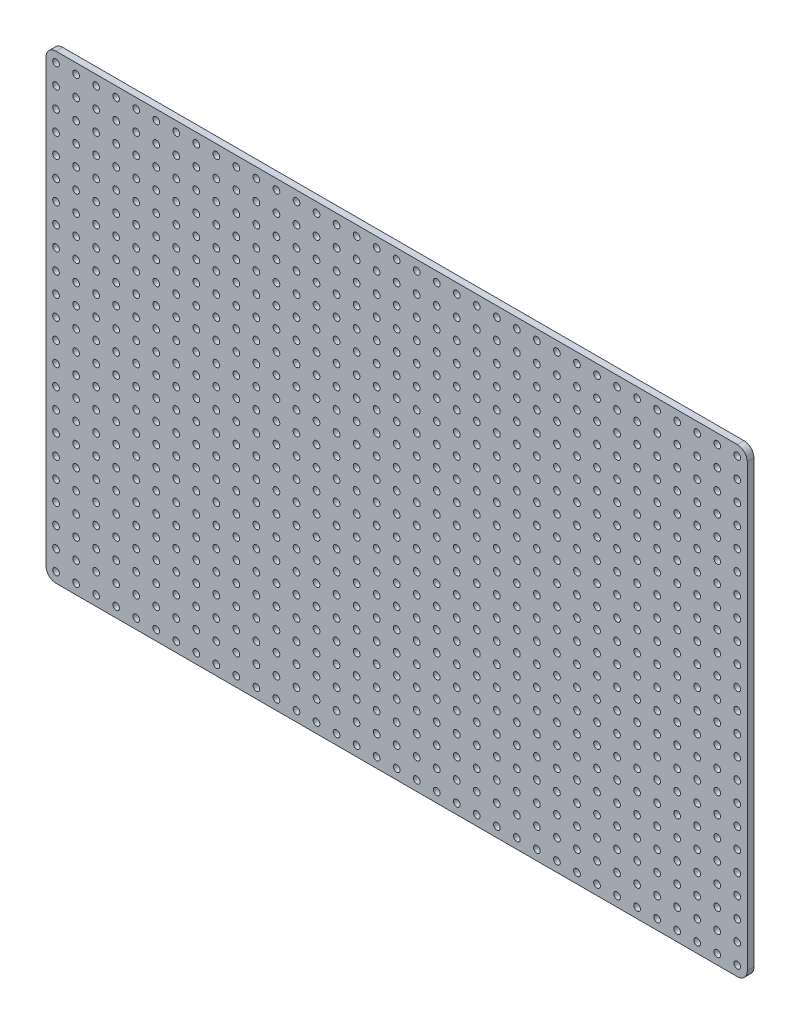
from build123d import *

# Parameters (mm, degrees)
MODEL_R                 = 1.5
SALIENTE_EXTRUIR1_DEPTH = 3


with BuildPart() as part:
    # Model → Saliente-Extruir1 (new body)
    with BuildSketch(Plane.XY):
        with BuildLine():
            Line((256.429131311, 471.742243614), (562.429131311, 471.742243614))
            ThreePointArc((562.429131311, 471.742243614), (565.611111826, 470.424224129), (566.929131311, 467.242243614))
            Line((566.929131311, 467.242243614), (566.929131311, 269.242243614))
            ThreePointArc((566.929131311, 269.242243614), (565.611111826, 266.060263099), (562.429131311, 264.742243614))
            Line((562.429131311, 264.742243614), (256.429131311, 264.742243614))
            ThreePointArc((256.429131311, 264.742243614), (253.247150795, 266.060263099), (251.929131311, 269.242243614))
            Line((251.929131311, 269.242243614), (251.929131311, 467.242243614))
            ThreePointArc((251.929131311, 467.242243614), (253.247150795, 470.424224129), (256.429131311, 471.742243614))
        make_face()
        with Locations((256.429131311, 467.242243614)):
            Circle(MODEL_R, mode=Mode.SUBTRACT)
        with Locations((256.429131311, 458.242243614)):
            Circle(MODEL_R, mode=Mode.SUBTRACT)
        with Locations((256.429131311, 449.242243614)):
            Circle(MODEL_R, mode=Mode.SUBTRACT)
        with Locations((256.429131311, 440.242243614)):
            Circle(MODEL_R, mode=Mode.SUBTRACT)
        with Locations((256.429131311, 431.242243614)):
            Circle(MODEL_R, mode=Mode.SUBTRACT)
        with Locations((256.429131311, 422.242243614)):
            Circle(MODEL_R, mode=Mode.SUBTRACT)
        with Locations((256.429131311, 413.242243614)):
            Circle(MODEL_R, mode=Mode.SUBTRACT)
        with Locations((256.429131311, 404.242243614)):
            Circle(MODEL_R, mode=Mode.SUBTRACT)
        with Locations((256.429131311, 395.242243614)):
            Circle(MODEL_R, mode=Mode.SUBTRACT)
        with Locations((256.429131311, 386.242243614)):
            Circle(MODEL_R, mode=Mode.SUBTRACT)
        with Locations((256.429131311, 377.242243614)):
            Circle(MODEL_R, mode=Mode.SUBTRACT)
        with Locations((256.429131311, 368.242243614)):
            Circle(MODEL_R, mode=Mode.SUBTRACT)
        with Locations((256.429131311, 359.242243614)):
            Circle(MODEL_R, mode=Mode.SUBTRACT)
        with Locations((256.429131311, 350.242243614)):
            Circle(MODEL_R, mode=Mode.SUBTRACT)
        with Locations((256.429131311, 341.242243614)):
            Circle(MODEL_R, mode=Mode.SUBTRACT)
        with Locations((256.429131311, 332.242243614)):
            Circle(MODEL_R, mode=Mode.SUBTRACT)
        with Locations((256.429131311, 323.242243614)):
            Circle(MODEL_R, mode=Mode.SUBTRACT)
        with Locations((256.429131311, 314.242243614)):
            Circle(MODEL_R, mode=Mode.SUBTRACT)
        with Locations((256.429131311, 305.242243614)):
            Circle(MODEL_R, mode=Mode.SUBTRACT)
        with Locations((265.429131311, 467.242243614)):
            Circle(MODEL_R, mode=Mode.SUBTRACT)
        with Locations((265.429131311, 458.242243614)):
            Circle(MODEL_R, mode=Mode.SUBTRACT)
        with Locations((265.429131311, 449.242243614)):
            Circle(MODEL_R, mode=Mode.SUBTRACT)
        with Locations((265.429131311, 440.242243614)):
            Circle(MODEL_R, mode=Mode.SUBTRACT)
        with Locations((265.429131311, 431.242243614)):
            Circle(MODEL_R, mode=Mode.SUBTRACT)
        with Locations((265.429131311, 422.242243614)):
            Circle(MODEL_R, mode=Mode.SUBTRACT)
        with Locations((265.429131311, 413.242243614)):
            Circle(MODEL_R, mode=Mode.SUBTRACT)
        with Locations((265.429131311, 404.242243614)):
            Circle(MODEL_R, mode=Mode.SUBTRACT)
        with Locations((265.429131311, 395.242243614)):
            Circle(MODEL_R, mode=Mode.SUBTRACT)
        with Locations((265.429131311, 386.242243614)):
            Circle(MODEL_R, mode=Mode.SUBTRACT)
        with Locations((265.429131311, 377.242243614)):
            Circle(MODEL_R, mode=Mode.SUBTRACT)
        with Locations((265.429131311, 368.242243614)):
            Circle(MODEL_R, mode=Mode.SUBTRACT)
        with Locations((265.429131311, 359.242243614)):
            Circle(MODEL_R, mode=Mode.SUBTRACT)
        with Locations((265.429131311, 350.242243614)):
            Circle(MODEL_R, mode=Mode.SUBTRACT)
        with Locations((265.429131311, 341.242243614)):
            Circle(MODEL_R, mode=Mode.SUBTRACT)
        with Locations((265.429131311, 332.242243614)):
            Circle(MODEL_R, mode=Mode.SUBTRACT)
        with Locations((265.429131311, 323.242243614)):
            Circle(MODEL_R, mode=Mode.SUBTRACT)
        with Locations((265.429131311, 314.242243614)):
            Circle(MODEL_R, mode=Mode.SUBTRACT)
        with Locations((265.429131311, 305.242243614)):
            Circle(MODEL_R, mode=Mode.SUBTRACT)
        with Locations((274.429131311, 467.242243614)):
            Circle(MODEL_R, mode=Mode.SUBTRACT)
        with Locations((274.429131311, 458.242243614)):
            Circle(MODEL_R, mode=Mode.SUBTRACT)
        with Locations((274.429131311, 449.242243614)):
            Circle(MODEL_R, mode=Mode.SUBTRACT)
        with Locations((274.429131311, 440.242243614)):
            Circle(MODEL_R, mode=Mode.SUBTRACT)
        with Locations((274.429131311, 431.242243614)):
            Circle(MODEL_R, mode=Mode.SUBTRACT)
        with Locations((274.429131311, 422.242243614)):
            Circle(MODEL_R, mode=Mode.SUBTRACT)
        with Locations((274.429131311, 413.242243614)):
            Circle(MODEL_R, mode=Mode.SUBTRACT)
        with Locations((274.429131311, 404.242243614)):
            Circle(MODEL_R, mode=Mode.SUBTRACT)
        with Locations((274.429131311, 395.242243614)):
            Circle(MODEL_R, mode=Mode.SUBTRACT)
        with Locations((274.429131311, 386.242243614)):
            Circle(MODEL_R, mode=Mode.SUBTRACT)
        with Locations((274.429131311, 377.242243614)):
            Circle(MODEL_R, mode=Mode.SUBTRACT)
        with Locations((274.429131311, 368.242243614)):
            Circle(MODEL_R, mode=Mode.SUBTRACT)
        with Locations((274.429131311, 359.242243614)):
            Circle(MODEL_R, mode=Mode.SUBTRACT)
        with Locations((274.429131311, 350.242243614)):
            Circle(MODEL_R, mode=Mode.SUBTRACT)
        with Locations((274.429131311, 341.242243614)):
            Circle(MODEL_R, mode=Mode.SUBTRACT)
        with Locations((274.429131311, 332.242243614)):
            Circle(MODEL_R, mode=Mode.SUBTRACT)
        with Locations((274.429131311, 323.242243614)):
            Circle(MODEL_R, mode=Mode.SUBTRACT)
        with Locations((274.429131311, 314.242243614)):
            Circle(MODEL_R, mode=Mode.SUBTRACT)
        with Locations((274.429131311, 305.242243614)):
            Circle(MODEL_R, mode=Mode.SUBTRACT)
        with Locations((283.429131311, 467.242243614)):
            Circle(MODEL_R, mode=Mode.SUBTRACT)
        with Locations((283.429131311, 458.242243614)):
            Circle(MODEL_R, mode=Mode.SUBTRACT)
        with Locations((283.429131311, 449.242243614)):
            Circle(MODEL_R, mode=Mode.SUBTRACT)
        with Locations((283.429131311, 440.242243614)):
            Circle(MODEL_R, mode=Mode.SUBTRACT)
        with Locations((283.429131311, 431.242243614)):
            Circle(MODEL_R, mode=Mode.SUBTRACT)
        with Locations((283.429131311, 422.242243614)):
            Circle(MODEL_R, mode=Mode.SUBTRACT)
        with Locations((283.429131311, 413.242243614)):
            Circle(MODEL_R, mode=Mode.SUBTRACT)
        with Locations((283.429131311, 404.242243614)):
            Circle(MODEL_R, mode=Mode.SUBTRACT)
        with Locations((283.429131311, 395.242243614)):
            Circle(MODEL_R, mode=Mode.SUBTRACT)
        with Locations((283.429131311, 386.242243614)):
            Circle(MODEL_R, mode=Mode.SUBTRACT)
        with Locations((283.429131311, 377.242243614)):
            Circle(MODEL_R, mode=Mode.SUBTRACT)
        with Locations((283.429131311, 368.242243614)):
            Circle(MODEL_R, mode=Mode.SUBTRACT)
        with Locations((283.429131311, 359.242243614)):
            Circle(MODEL_R, mode=Mode.SUBTRACT)
        with Locations((283.429131311, 350.242243614)):
            Circle(MODEL_R, mode=Mode.SUBTRACT)
        with Locations((283.429131311, 341.242243614)):
            Circle(MODEL_R, mode=Mode.SUBTRACT)
        with Locations((283.429131311, 332.242243614)):
            Circle(MODEL_R, mode=Mode.SUBTRACT)
        with Locations((283.429131311, 323.242243614)):
            Circle(MODEL_R, mode=Mode.SUBTRACT)
        with Locations((283.429131311, 314.242243614)):
            Circle(MODEL_R, mode=Mode.SUBTRACT)
        with Locations((283.429131311, 305.242243614)):
            Circle(MODEL_R, mode=Mode.SUBTRACT)
        with Locations((292.429131311, 467.242243614)):
            Circle(MODEL_R, mode=Mode.SUBTRACT)
        with Locations((292.429131311, 458.242243614)):
            Circle(MODEL_R, mode=Mode.SUBTRACT)
        with Locations((292.429131311, 449.242243614)):
            Circle(MODEL_R, mode=Mode.SUBTRACT)
        with Locations((292.429131311, 440.242243614)):
            Circle(MODEL_R, mode=Mode.SUBTRACT)
        with Locations((292.429131311, 431.242243614)):
            Circle(MODEL_R, mode=Mode.SUBTRACT)
        with Locations((292.429131311, 422.242243614)):
            Circle(MODEL_R, mode=Mode.SUBTRACT)
        with Locations((292.429131311, 413.242243614)):
            Circle(MODEL_R, mode=Mode.SUBTRACT)
        with Locations((292.429131311, 404.242243614)):
            Circle(MODEL_R, mode=Mode.SUBTRACT)
        with Locations((292.429131311, 395.242243614)):
            Circle(MODEL_R, mode=Mode.SUBTRACT)
        with Locations((292.429131311, 386.242243614)):
            Circle(MODEL_R, mode=Mode.SUBTRACT)
        with Locations((292.429131311, 377.242243614)):
            Circle(MODEL_R, mode=Mode.SUBTRACT)
        with Locations((292.429131311, 368.242243614)):
            Circle(MODEL_R, mode=Mode.SUBTRACT)
        with Locations((292.429131311, 359.242243614)):
            Circle(MODEL_R, mode=Mode.SUBTRACT)
        with Locations((292.429131311, 350.242243614)):
            Circle(MODEL_R, mode=Mode.SUBTRACT)
        with Locations((292.429131311, 341.242243614)):
            Circle(MODEL_R, mode=Mode.SUBTRACT)
        with Locations((292.429131311, 332.242243614)):
            Circle(MODEL_R, mode=Mode.SUBTRACT)
        with Locations((292.429131311, 323.242243614)):
            Circle(MODEL_R, mode=Mode.SUBTRACT)
        with Locations((292.429131311, 314.242243614)):
            Circle(MODEL_R, mode=Mode.SUBTRACT)
        with Locations((292.429131311, 305.242243614)):
            Circle(MODEL_R, mode=Mode.SUBTRACT)
        with Locations((301.429131311, 467.242243614)):
            Circle(MODEL_R, mode=Mode.SUBTRACT)
        with Locations((301.429131311, 458.242243614)):
            Circle(MODEL_R, mode=Mode.SUBTRACT)
        with Locations((301.429131311, 449.242243614)):
            Circle(MODEL_R, mode=Mode.SUBTRACT)
        with Locations((301.429131311, 440.242243614)):
            Circle(MODEL_R, mode=Mode.SUBTRACT)
        with Locations((301.429131311, 431.242243614)):
            Circle(MODEL_R, mode=Mode.SUBTRACT)
        with Locations((301.429131311, 422.242243614)):
            Circle(MODEL_R, mode=Mode.SUBTRACT)
        with Locations((301.429131311, 413.242243614)):
            Circle(MODEL_R, mode=Mode.SUBTRACT)
        with Locations((301.429131311, 404.242243614)):
            Circle(MODEL_R, mode=Mode.SUBTRACT)
        with Locations((301.429131311, 395.242243614)):
            Circle(MODEL_R, mode=Mode.SUBTRACT)
        with Locations((301.429131311, 386.242243614)):
            Circle(MODEL_R, mode=Mode.SUBTRACT)
        with Locations((301.429131311, 377.242243614)):
            Circle(MODEL_R, mode=Mode.SUBTRACT)
        with Locations((301.429131311, 368.242243614)):
            Circle(MODEL_R, mode=Mode.SUBTRACT)
        with Locations((301.429131311, 359.242243614)):
            Circle(MODEL_R, mode=Mode.SUBTRACT)
        with Locations((301.429131311, 350.242243614)):
            Circle(MODEL_R, mode=Mode.SUBTRACT)
        with Locations((301.429131311, 341.242243614)):
            Circle(MODEL_R, mode=Mode.SUBTRACT)
        with Locations((301.429131311, 332.242243614)):
            Circle(MODEL_R, mode=Mode.SUBTRACT)
        with Locations((301.429131311, 323.242243614)):
            Circle(MODEL_R, mode=Mode.SUBTRACT)
        with Locations((301.429131311, 314.242243614)):
            Circle(MODEL_R, mode=Mode.SUBTRACT)
        with Locations((301.429131311, 305.242243614)):
            Circle(MODEL_R, mode=Mode.SUBTRACT)
        with Locations((310.429131311, 467.242243614)):
            Circle(MODEL_R, mode=Mode.SUBTRACT)
        with Locations((310.429131311, 458.242243614)):
            Circle(MODEL_R, mode=Mode.SUBTRACT)
        with Locations((310.429131311, 449.242243614)):
            Circle(MODEL_R, mode=Mode.SUBTRACT)
        with Locations((310.429131311, 440.242243614)):
            Circle(MODEL_R, mode=Mode.SUBTRACT)
        with Locations((310.429131311, 431.242243614)):
            Circle(MODEL_R, mode=Mode.SUBTRACT)
        with Locations((310.429131311, 422.242243614)):
            Circle(MODEL_R, mode=Mode.SUBTRACT)
        with Locations((310.429131311, 413.242243614)):
            Circle(MODEL_R, mode=Mode.SUBTRACT)
        with Locations((310.429131311, 404.242243614)):
            Circle(MODEL_R, mode=Mode.SUBTRACT)
        with Locations((310.429131311, 395.242243614)):
            Circle(MODEL_R, mode=Mode.SUBTRACT)
        with Locations((310.429131311, 386.242243614)):
            Circle(MODEL_R, mode=Mode.SUBTRACT)
        with Locations((310.429131311, 377.242243614)):
            Circle(MODEL_R, mode=Mode.SUBTRACT)
        with Locations((310.429131311, 368.242243614)):
            Circle(MODEL_R, mode=Mode.SUBTRACT)
        with Locations((310.429131311, 359.242243614)):
            Circle(MODEL_R, mode=Mode.SUBTRACT)
        with Locations((310.429131311, 350.242243614)):
            Circle(MODEL_R, mode=Mode.SUBTRACT)
        with Locations((310.429131311, 341.242243614)):
            Circle(MODEL_R, mode=Mode.SUBTRACT)
        with Locations((310.429131311, 332.242243614)):
            Circle(MODEL_R, mode=Mode.SUBTRACT)
        with Locations((310.429131311, 323.242243614)):
            Circle(MODEL_R, mode=Mode.SUBTRACT)
        with Locations((310.429131311, 314.242243614)):
            Circle(MODEL_R, mode=Mode.SUBTRACT)
        with Locations((310.429131311, 305.242243614)):
            Circle(MODEL_R, mode=Mode.SUBTRACT)
        with Locations((319.429131311, 467.242243614)):
            Circle(MODEL_R, mode=Mode.SUBTRACT)
        with Locations((319.429131311, 458.242243614)):
            Circle(MODEL_R, mode=Mode.SUBTRACT)
        with Locations((319.429131311, 449.242243614)):
            Circle(MODEL_R, mode=Mode.SUBTRACT)
        with Locations((319.429131311, 440.242243614)):
            Circle(MODEL_R, mode=Mode.SUBTRACT)
        with Locations((319.429131311, 431.242243614)):
            Circle(MODEL_R, mode=Mode.SUBTRACT)
        with Locations((319.429131311, 422.242243614)):
            Circle(MODEL_R, mode=Mode.SUBTRACT)
        with Locations((319.429131311, 413.242243614)):
            Circle(MODEL_R, mode=Mode.SUBTRACT)
        with Locations((319.429131311, 404.242243614)):
            Circle(MODEL_R, mode=Mode.SUBTRACT)
        with Locations((319.429131311, 395.242243614)):
            Circle(MODEL_R, mode=Mode.SUBTRACT)
        with Locations((319.429131311, 386.242243614)):
            Circle(MODEL_R, mode=Mode.SUBTRACT)
        with Locations((319.429131311, 377.242243614)):
            Circle(MODEL_R, mode=Mode.SUBTRACT)
        with Locations((319.429131311, 368.242243614)):
            Circle(MODEL_R, mode=Mode.SUBTRACT)
        with Locations((319.429131311, 359.242243614)):
            Circle(MODEL_R, mode=Mode.SUBTRACT)
        with Locations((319.429131311, 350.242243614)):
            Circle(MODEL_R, mode=Mode.SUBTRACT)
        with Locations((319.429131311, 341.242243614)):
            Circle(MODEL_R, mode=Mode.SUBTRACT)
        with Locations((319.429131311, 332.242243614)):
            Circle(MODEL_R, mode=Mode.SUBTRACT)
        with Locations((319.429131311, 323.242243614)):
            Circle(MODEL_R, mode=Mode.SUBTRACT)
        with Locations((319.429131311, 314.242243614)):
            Circle(MODEL_R, mode=Mode.SUBTRACT)
        with Locations((319.429131311, 305.242243614)):
            Circle(MODEL_R, mode=Mode.SUBTRACT)
        with Locations((328.429131311, 467.242243614)):
            Circle(MODEL_R, mode=Mode.SUBTRACT)
        with Locations((328.429131311, 458.242243614)):
            Circle(MODEL_R, mode=Mode.SUBTRACT)
        with Locations((328.429131311, 449.242243614)):
            Circle(MODEL_R, mode=Mode.SUBTRACT)
        with Locations((328.429131311, 440.242243614)):
            Circle(MODEL_R, mode=Mode.SUBTRACT)
        with Locations((328.429131311, 431.242243614)):
            Circle(MODEL_R, mode=Mode.SUBTRACT)
        with Locations((328.429131311, 422.242243614)):
            Circle(MODEL_R, mode=Mode.SUBTRACT)
        with Locations((328.429131311, 413.242243614)):
            Circle(MODEL_R, mode=Mode.SUBTRACT)
        with Locations((328.429131311, 404.242243614)):
            Circle(MODEL_R, mode=Mode.SUBTRACT)
        with Locations((328.429131311, 395.242243614)):
            Circle(MODEL_R, mode=Mode.SUBTRACT)
        with Locations((328.429131311, 386.242243614)):
            Circle(MODEL_R, mode=Mode.SUBTRACT)
        with Locations((328.429131311, 377.242243614)):
            Circle(MODEL_R, mode=Mode.SUBTRACT)
        with Locations((328.429131311, 368.242243614)):
            Circle(MODEL_R, mode=Mode.SUBTRACT)
        with Locations((328.429131311, 359.242243614)):
            Circle(MODEL_R, mode=Mode.SUBTRACT)
        with Locations((328.429131311, 350.242243614)):
            Circle(MODEL_R, mode=Mode.SUBTRACT)
        with Locations((328.429131311, 341.242243614)):
            Circle(MODEL_R, mode=Mode.SUBTRACT)
        with Locations((328.429131311, 332.242243614)):
            Circle(MODEL_R, mode=Mode.SUBTRACT)
        with Locations((328.429131311, 323.242243614)):
            Circle(MODEL_R, mode=Mode.SUBTRACT)
        with Locations((328.429131311, 314.242243614)):
            Circle(MODEL_R, mode=Mode.SUBTRACT)
        with Locations((328.429131311, 305.242243614)):
            Circle(MODEL_R, mode=Mode.SUBTRACT)
        with Locations((337.429131311, 467.242243614)):
            Circle(MODEL_R, mode=Mode.SUBTRACT)
        with Locations((337.429131311, 458.242243614)):
            Circle(MODEL_R, mode=Mode.SUBTRACT)
        with Locations((337.429131311, 449.242243614)):
            Circle(MODEL_R, mode=Mode.SUBTRACT)
        with Locations((337.429131311, 440.242243614)):
            Circle(MODEL_R, mode=Mode.SUBTRACT)
        with Locations((337.429131311, 431.242243614)):
            Circle(MODEL_R, mode=Mode.SUBTRACT)
        with Locations((337.429131311, 422.242243614)):
            Circle(MODEL_R, mode=Mode.SUBTRACT)
        with Locations((337.429131311, 413.242243614)):
            Circle(MODEL_R, mode=Mode.SUBTRACT)
        with Locations((337.429131311, 404.242243614)):
            Circle(MODEL_R, mode=Mode.SUBTRACT)
        with Locations((337.429131311, 395.242243614)):
            Circle(MODEL_R, mode=Mode.SUBTRACT)
        with Locations((337.429131311, 386.242243614)):
            Circle(MODEL_R, mode=Mode.SUBTRACT)
        with Locations((337.429131311, 377.242243614)):
            Circle(MODEL_R, mode=Mode.SUBTRACT)
        with Locations((337.429131311, 368.242243614)):
            Circle(MODEL_R, mode=Mode.SUBTRACT)
        with Locations((337.429131311, 359.242243614)):
            Circle(MODEL_R, mode=Mode.SUBTRACT)
        with Locations((337.429131311, 350.242243614)):
            Circle(MODEL_R, mode=Mode.SUBTRACT)
        with Locations((337.429131311, 341.242243614)):
            Circle(MODEL_R, mode=Mode.SUBTRACT)
        with Locations((337.429131311, 332.242243614)):
            Circle(MODEL_R, mode=Mode.SUBTRACT)
        with Locations((337.429131311, 323.242243614)):
            Circle(MODEL_R, mode=Mode.SUBTRACT)
        with Locations((337.429131311, 314.242243614)):
            Circle(MODEL_R, mode=Mode.SUBTRACT)
        with Locations((337.429131311, 305.242243614)):
            Circle(MODEL_R, mode=Mode.SUBTRACT)
        with Locations((346.429131311, 467.242243614)):
            Circle(MODEL_R, mode=Mode.SUBTRACT)
        with Locations((346.429131311, 458.242243614)):
            Circle(MODEL_R, mode=Mode.SUBTRACT)
        with Locations((346.429131311, 449.242243614)):
            Circle(MODEL_R, mode=Mode.SUBTRACT)
        with Locations((346.429131311, 440.242243614)):
            Circle(MODEL_R, mode=Mode.SUBTRACT)
        with Locations((346.429131311, 431.242243614)):
            Circle(MODEL_R, mode=Mode.SUBTRACT)
        with Locations((346.429131311, 422.242243614)):
            Circle(MODEL_R, mode=Mode.SUBTRACT)
        with Locations((346.429131311, 413.242243614)):
            Circle(MODEL_R, mode=Mode.SUBTRACT)
        with Locations((346.429131311, 404.242243614)):
            Circle(MODEL_R, mode=Mode.SUBTRACT)
        with Locations((346.429131311, 395.242243614)):
            Circle(MODEL_R, mode=Mode.SUBTRACT)
        with Locations((346.429131311, 386.242243614)):
            Circle(MODEL_R, mode=Mode.SUBTRACT)
        with Locations((346.429131311, 377.242243614)):
            Circle(MODEL_R, mode=Mode.SUBTRACT)
        with Locations((346.429131311, 368.242243614)):
            Circle(MODEL_R, mode=Mode.SUBTRACT)
        with Locations((346.429131311, 359.242243614)):
            Circle(MODEL_R, mode=Mode.SUBTRACT)
        with Locations((346.429131311, 350.242243614)):
            Circle(MODEL_R, mode=Mode.SUBTRACT)
        with Locations((346.429131311, 341.242243614)):
            Circle(MODEL_R, mode=Mode.SUBTRACT)
        with Locations((346.429131311, 332.242243614)):
            Circle(MODEL_R, mode=Mode.SUBTRACT)
        with Locations((346.429131311, 323.242243614)):
            Circle(MODEL_R, mode=Mode.SUBTRACT)
        with Locations((346.429131311, 314.242243614)):
            Circle(MODEL_R, mode=Mode.SUBTRACT)
        with Locations((346.429131311, 305.242243614)):
            Circle(MODEL_R, mode=Mode.SUBTRACT)
        with Locations((355.429131311, 467.242243614)):
            Circle(MODEL_R, mode=Mode.SUBTRACT)
        with Locations((355.429131311, 458.242243614)):
            Circle(MODEL_R, mode=Mode.SUBTRACT)
        with Locations((355.429131311, 449.242243614)):
            Circle(MODEL_R, mode=Mode.SUBTRACT)
        with Locations((355.429131311, 440.242243614)):
            Circle(MODEL_R, mode=Mode.SUBTRACT)
        with Locations((355.429131311, 431.242243614)):
            Circle(MODEL_R, mode=Mode.SUBTRACT)
        with Locations((355.429131311, 422.242243614)):
            Circle(MODEL_R, mode=Mode.SUBTRACT)
        with Locations((355.429131311, 413.242243614)):
            Circle(MODEL_R, mode=Mode.SUBTRACT)
        with Locations((355.429131311, 404.242243614)):
            Circle(MODEL_R, mode=Mode.SUBTRACT)
        with Locations((355.429131311, 395.242243614)):
            Circle(MODEL_R, mode=Mode.SUBTRACT)
        with Locations((355.429131311, 386.242243614)):
            Circle(MODEL_R, mode=Mode.SUBTRACT)
        with Locations((355.429131311, 377.242243614)):
            Circle(MODEL_R, mode=Mode.SUBTRACT)
        with Locations((355.429131311, 368.242243614)):
            Circle(MODEL_R, mode=Mode.SUBTRACT)
        with Locations((355.429131311, 359.242243614)):
            Circle(MODEL_R, mode=Mode.SUBTRACT)
        with Locations((355.429131311, 350.242243614)):
            Circle(MODEL_R, mode=Mode.SUBTRACT)
        with Locations((355.429131311, 341.242243614)):
            Circle(MODEL_R, mode=Mode.SUBTRACT)
        with Locations((355.429131311, 332.242243614)):
            Circle(MODEL_R, mode=Mode.SUBTRACT)
        with Locations((355.429131311, 323.242243614)):
            Circle(MODEL_R, mode=Mode.SUBTRACT)
        with Locations((355.429131311, 314.242243614)):
            Circle(MODEL_R, mode=Mode.SUBTRACT)
        with Locations((355.429131311, 305.242243614)):
            Circle(MODEL_R, mode=Mode.SUBTRACT)
        with Locations((364.429131311, 467.242243614)):
            Circle(MODEL_R, mode=Mode.SUBTRACT)
        with Locations((364.429131311, 458.242243614)):
            Circle(MODEL_R, mode=Mode.SUBTRACT)
        with Locations((364.429131311, 449.242243614)):
            Circle(MODEL_R, mode=Mode.SUBTRACT)
        with Locations((364.429131311, 440.242243614)):
            Circle(MODEL_R, mode=Mode.SUBTRACT)
        with Locations((364.429131311, 431.242243614)):
            Circle(MODEL_R, mode=Mode.SUBTRACT)
        with Locations((364.429131311, 422.242243614)):
            Circle(MODEL_R, mode=Mode.SUBTRACT)
        with Locations((364.429131311, 413.242243614)):
            Circle(MODEL_R, mode=Mode.SUBTRACT)
        with Locations((364.429131311, 404.242243614)):
            Circle(MODEL_R, mode=Mode.SUBTRACT)
        with Locations((364.429131311, 395.242243614)):
            Circle(MODEL_R, mode=Mode.SUBTRACT)
        with Locations((364.429131311, 386.242243614)):
            Circle(MODEL_R, mode=Mode.SUBTRACT)
        with Locations((364.429131311, 377.242243614)):
            Circle(MODEL_R, mode=Mode.SUBTRACT)
        with Locations((364.429131311, 368.242243614)):
            Circle(MODEL_R, mode=Mode.SUBTRACT)
        with Locations((364.429131311, 359.242243614)):
            Circle(MODEL_R, mode=Mode.SUBTRACT)
        with Locations((364.429131311, 350.242243614)):
            Circle(MODEL_R, mode=Mode.SUBTRACT)
        with Locations((364.429131311, 341.242243614)):
            Circle(MODEL_R, mode=Mode.SUBTRACT)
        with Locations((364.429131311, 332.242243614)):
            Circle(MODEL_R, mode=Mode.SUBTRACT)
        with Locations((364.429131311, 323.242243614)):
            Circle(MODEL_R, mode=Mode.SUBTRACT)
        with Locations((364.429131311, 314.242243614)):
            Circle(MODEL_R, mode=Mode.SUBTRACT)
        with Locations((364.429131311, 305.242243614)):
            Circle(MODEL_R, mode=Mode.SUBTRACT)
        with Locations((373.429131311, 467.242243614)):
            Circle(MODEL_R, mode=Mode.SUBTRACT)
        with Locations((373.429131311, 458.242243614)):
            Circle(MODEL_R, mode=Mode.SUBTRACT)
        with Locations((373.429131311, 449.242243614)):
            Circle(MODEL_R, mode=Mode.SUBTRACT)
        with Locations((373.429131311, 440.242243614)):
            Circle(MODEL_R, mode=Mode.SUBTRACT)
        with Locations((373.429131311, 431.242243614)):
            Circle(MODEL_R, mode=Mode.SUBTRACT)
        with Locations((373.429131311, 422.242243614)):
            Circle(MODEL_R, mode=Mode.SUBTRACT)
        with Locations((373.429131311, 413.242243614)):
            Circle(MODEL_R, mode=Mode.SUBTRACT)
        with Locations((373.429131311, 404.242243614)):
            Circle(MODEL_R, mode=Mode.SUBTRACT)
        with Locations((373.429131311, 395.242243614)):
            Circle(MODEL_R, mode=Mode.SUBTRACT)
        with Locations((373.429131311, 386.242243614)):
            Circle(MODEL_R, mode=Mode.SUBTRACT)
        with Locations((373.429131311, 377.242243614)):
            Circle(MODEL_R, mode=Mode.SUBTRACT)
        with Locations((373.429131311, 368.242243614)):
            Circle(MODEL_R, mode=Mode.SUBTRACT)
        with Locations((373.429131311, 359.242243614)):
            Circle(MODEL_R, mode=Mode.SUBTRACT)
        with Locations((373.429131311, 350.242243614)):
            Circle(MODEL_R, mode=Mode.SUBTRACT)
        with Locations((373.429131311, 341.242243614)):
            Circle(MODEL_R, mode=Mode.SUBTRACT)
        with Locations((373.429131311, 332.242243614)):
            Circle(MODEL_R, mode=Mode.SUBTRACT)
        with Locations((373.429131311, 323.242243614)):
            Circle(MODEL_R, mode=Mode.SUBTRACT)
        with Locations((373.429131311, 314.242243614)):
            Circle(MODEL_R, mode=Mode.SUBTRACT)
        with Locations((373.429131311, 305.242243614)):
            Circle(MODEL_R, mode=Mode.SUBTRACT)
        with Locations((382.429131311, 467.242243614)):
            Circle(MODEL_R, mode=Mode.SUBTRACT)
        with Locations((382.429131311, 458.242243614)):
            Circle(MODEL_R, mode=Mode.SUBTRACT)
        with Locations((382.429131311, 449.242243614)):
            Circle(MODEL_R, mode=Mode.SUBTRACT)
        with Locations((382.429131311, 440.242243614)):
            Circle(MODEL_R, mode=Mode.SUBTRACT)
        with Locations((382.429131311, 431.242243614)):
            Circle(MODEL_R, mode=Mode.SUBTRACT)
        with Locations((382.429131311, 422.242243614)):
            Circle(MODEL_R, mode=Mode.SUBTRACT)
        with Locations((382.429131311, 413.242243614)):
            Circle(MODEL_R, mode=Mode.SUBTRACT)
        with Locations((382.429131311, 404.242243614)):
            Circle(MODEL_R, mode=Mode.SUBTRACT)
        with Locations((382.429131311, 395.242243614)):
            Circle(MODEL_R, mode=Mode.SUBTRACT)
        with Locations((382.429131311, 386.242243614)):
            Circle(MODEL_R, mode=Mode.SUBTRACT)
        with Locations((382.429131311, 377.242243614)):
            Circle(MODEL_R, mode=Mode.SUBTRACT)
        with Locations((382.429131311, 368.242243614)):
            Circle(MODEL_R, mode=Mode.SUBTRACT)
        with Locations((382.429131311, 359.242243614)):
            Circle(MODEL_R, mode=Mode.SUBTRACT)
        with Locations((382.429131311, 350.242243614)):
            Circle(MODEL_R, mode=Mode.SUBTRACT)
        with Locations((382.429131311, 341.242243614)):
            Circle(MODEL_R, mode=Mode.SUBTRACT)
        with Locations((382.429131311, 332.242243614)):
            Circle(MODEL_R, mode=Mode.SUBTRACT)
        with Locations((382.429131311, 323.242243614)):
            Circle(MODEL_R, mode=Mode.SUBTRACT)
        with Locations((382.429131311, 314.242243614)):
            Circle(MODEL_R, mode=Mode.SUBTRACT)
        with Locations((382.429131311, 305.242243614)):
            Circle(MODEL_R, mode=Mode.SUBTRACT)
        with Locations((391.429131311, 467.242243614)):
            Circle(MODEL_R, mode=Mode.SUBTRACT)
        with Locations((391.429131311, 458.242243614)):
            Circle(MODEL_R, mode=Mode.SUBTRACT)
        with Locations((391.429131311, 449.242243614)):
            Circle(MODEL_R, mode=Mode.SUBTRACT)
        with Locations((391.429131311, 440.242243614)):
            Circle(MODEL_R, mode=Mode.SUBTRACT)
        with Locations((391.429131311, 431.242243614)):
            Circle(MODEL_R, mode=Mode.SUBTRACT)
        with Locations((391.429131311, 422.242243614)):
            Circle(MODEL_R, mode=Mode.SUBTRACT)
        with Locations((391.429131311, 413.242243614)):
            Circle(MODEL_R, mode=Mode.SUBTRACT)
        with Locations((391.429131311, 404.242243614)):
            Circle(MODEL_R, mode=Mode.SUBTRACT)
        with Locations((391.429131311, 395.242243614)):
            Circle(MODEL_R, mode=Mode.SUBTRACT)
        with Locations((391.429131311, 386.242243614)):
            Circle(MODEL_R, mode=Mode.SUBTRACT)
        with Locations((391.429131311, 377.242243614)):
            Circle(MODEL_R, mode=Mode.SUBTRACT)
        with Locations((391.429131311, 368.242243614)):
            Circle(MODEL_R, mode=Mode.SUBTRACT)
        with Locations((391.429131311, 359.242243614)):
            Circle(MODEL_R, mode=Mode.SUBTRACT)
        with Locations((391.429131311, 350.242243614)):
            Circle(MODEL_R, mode=Mode.SUBTRACT)
        with Locations((391.429131311, 341.242243614)):
            Circle(MODEL_R, mode=Mode.SUBTRACT)
        with Locations((391.429131311, 332.242243614)):
            Circle(MODEL_R, mode=Mode.SUBTRACT)
        with Locations((391.429131311, 323.242243614)):
            Circle(MODEL_R, mode=Mode.SUBTRACT)
        with Locations((391.429131311, 314.242243614)):
            Circle(MODEL_R, mode=Mode.SUBTRACT)
        with Locations((391.429131311, 305.242243614)):
            Circle(MODEL_R, mode=Mode.SUBTRACT)
        with Locations((400.429131311, 467.242243614)):
            Circle(MODEL_R, mode=Mode.SUBTRACT)
        with Locations((400.429131311, 458.242243614)):
            Circle(MODEL_R, mode=Mode.SUBTRACT)
        with Locations((400.429131311, 449.242243614)):
            Circle(MODEL_R, mode=Mode.SUBTRACT)
        with Locations((400.429131311, 440.242243614)):
            Circle(MODEL_R, mode=Mode.SUBTRACT)
        with Locations((400.429131311, 431.242243614)):
            Circle(MODEL_R, mode=Mode.SUBTRACT)
        with Locations((400.429131311, 422.242243614)):
            Circle(MODEL_R, mode=Mode.SUBTRACT)
        with Locations((400.429131311, 413.242243614)):
            Circle(MODEL_R, mode=Mode.SUBTRACT)
        with Locations((400.429131311, 404.242243614)):
            Circle(MODEL_R, mode=Mode.SUBTRACT)
        with Locations((400.429131311, 395.242243614)):
            Circle(MODEL_R, mode=Mode.SUBTRACT)
        with Locations((400.429131311, 386.242243614)):
            Circle(MODEL_R, mode=Mode.SUBTRACT)
        with Locations((400.429131311, 377.242243614)):
            Circle(MODEL_R, mode=Mode.SUBTRACT)
        with Locations((400.429131311, 368.242243614)):
            Circle(MODEL_R, mode=Mode.SUBTRACT)
        with Locations((400.429131311, 359.242243614)):
            Circle(MODEL_R, mode=Mode.SUBTRACT)
        with Locations((400.429131311, 350.242243614)):
            Circle(MODEL_R, mode=Mode.SUBTRACT)
        with Locations((400.429131311, 341.242243614)):
            Circle(MODEL_R, mode=Mode.SUBTRACT)
        with Locations((400.429131311, 332.242243614)):
            Circle(MODEL_R, mode=Mode.SUBTRACT)
        with Locations((400.429131311, 323.242243614)):
            Circle(MODEL_R, mode=Mode.SUBTRACT)
        with Locations((400.429131311, 314.242243614)):
            Circle(MODEL_R, mode=Mode.SUBTRACT)
        with Locations((400.429131311, 305.242243614)):
            Circle(MODEL_R, mode=Mode.SUBTRACT)
        with Locations((409.429131311, 467.242243614)):
            Circle(MODEL_R, mode=Mode.SUBTRACT)
        with Locations((409.429131311, 458.242243614)):
            Circle(MODEL_R, mode=Mode.SUBTRACT)
        with Locations((409.429131311, 449.242243614)):
            Circle(MODEL_R, mode=Mode.SUBTRACT)
        with Locations((409.429131311, 440.242243614)):
            Circle(MODEL_R, mode=Mode.SUBTRACT)
        with Locations((409.429131311, 431.242243614)):
            Circle(MODEL_R, mode=Mode.SUBTRACT)
        with Locations((409.429131311, 422.242243614)):
            Circle(MODEL_R, mode=Mode.SUBTRACT)
        with Locations((409.429131311, 413.242243614)):
            Circle(MODEL_R, mode=Mode.SUBTRACT)
        with Locations((409.429131311, 404.242243614)):
            Circle(MODEL_R, mode=Mode.SUBTRACT)
        with Locations((409.429131311, 395.242243614)):
            Circle(MODEL_R, mode=Mode.SUBTRACT)
        with Locations((409.429131311, 386.242243614)):
            Circle(MODEL_R, mode=Mode.SUBTRACT)
        with Locations((409.429131311, 377.242243614)):
            Circle(MODEL_R, mode=Mode.SUBTRACT)
        with Locations((409.429131311, 368.242243614)):
            Circle(MODEL_R, mode=Mode.SUBTRACT)
        with Locations((409.429131311, 359.242243614)):
            Circle(MODEL_R, mode=Mode.SUBTRACT)
        with Locations((409.429131311, 350.242243614)):
            Circle(MODEL_R, mode=Mode.SUBTRACT)
        with Locations((409.429131311, 341.242243614)):
            Circle(MODEL_R, mode=Mode.SUBTRACT)
        with Locations((409.429131311, 332.242243614)):
            Circle(MODEL_R, mode=Mode.SUBTRACT)
        with Locations((409.429131311, 323.242243614)):
            Circle(MODEL_R, mode=Mode.SUBTRACT)
        with Locations((409.429131311, 314.242243614)):
            Circle(MODEL_R, mode=Mode.SUBTRACT)
        with Locations((409.429131311, 305.242243614)):
            Circle(MODEL_R, mode=Mode.SUBTRACT)
        with Locations((418.429131311, 467.242243614)):
            Circle(MODEL_R, mode=Mode.SUBTRACT)
        with Locations((418.429131311, 458.242243614)):
            Circle(MODEL_R, mode=Mode.SUBTRACT)
        with Locations((418.429131311, 449.242243614)):
            Circle(MODEL_R, mode=Mode.SUBTRACT)
        with Locations((418.429131311, 440.242243614)):
            Circle(MODEL_R, mode=Mode.SUBTRACT)
        with Locations((418.429131311, 431.242243614)):
            Circle(MODEL_R, mode=Mode.SUBTRACT)
        with Locations((418.429131311, 422.242243614)):
            Circle(MODEL_R, mode=Mode.SUBTRACT)
        with Locations((418.429131311, 413.242243614)):
            Circle(MODEL_R, mode=Mode.SUBTRACT)
        with Locations((418.429131311, 404.242243614)):
            Circle(MODEL_R, mode=Mode.SUBTRACT)
        with Locations((418.429131311, 395.242243614)):
            Circle(MODEL_R, mode=Mode.SUBTRACT)
        with Locations((418.429131311, 386.242243614)):
            Circle(MODEL_R, mode=Mode.SUBTRACT)
        with Locations((418.429131311, 377.242243614)):
            Circle(MODEL_R, mode=Mode.SUBTRACT)
        with Locations((418.429131311, 368.242243614)):
            Circle(MODEL_R, mode=Mode.SUBTRACT)
        with Locations((418.429131311, 359.242243614)):
            Circle(MODEL_R, mode=Mode.SUBTRACT)
        with Locations((418.429131311, 350.242243614)):
            Circle(MODEL_R, mode=Mode.SUBTRACT)
        with Locations((418.429131311, 341.242243614)):
            Circle(MODEL_R, mode=Mode.SUBTRACT)
        with Locations((418.429131311, 332.242243614)):
            Circle(MODEL_R, mode=Mode.SUBTRACT)
        with Locations((418.429131311, 323.242243614)):
            Circle(MODEL_R, mode=Mode.SUBTRACT)
        with Locations((418.429131311, 314.242243614)):
            Circle(MODEL_R, mode=Mode.SUBTRACT)
        with Locations((418.429131311, 305.242243614)):
            Circle(MODEL_R, mode=Mode.SUBTRACT)
        with Locations((427.429131311, 467.242243614)):
            Circle(MODEL_R, mode=Mode.SUBTRACT)
        with Locations((427.429131311, 458.242243614)):
            Circle(MODEL_R, mode=Mode.SUBTRACT)
        with Locations((427.429131311, 449.242243614)):
            Circle(MODEL_R, mode=Mode.SUBTRACT)
        with Locations((427.429131311, 440.242243614)):
            Circle(MODEL_R, mode=Mode.SUBTRACT)
        with Locations((427.429131311, 431.242243614)):
            Circle(MODEL_R, mode=Mode.SUBTRACT)
        with Locations((427.429131311, 422.242243614)):
            Circle(MODEL_R, mode=Mode.SUBTRACT)
        with Locations((427.429131311, 413.242243614)):
            Circle(MODEL_R, mode=Mode.SUBTRACT)
        with Locations((427.429131311, 404.242243614)):
            Circle(MODEL_R, mode=Mode.SUBTRACT)
        with Locations((427.429131311, 395.242243614)):
            Circle(MODEL_R, mode=Mode.SUBTRACT)
        with Locations((427.429131311, 386.242243614)):
            Circle(MODEL_R, mode=Mode.SUBTRACT)
        with Locations((427.429131311, 377.242243614)):
            Circle(MODEL_R, mode=Mode.SUBTRACT)
        with Locations((427.429131311, 368.242243614)):
            Circle(MODEL_R, mode=Mode.SUBTRACT)
        with Locations((427.429131311, 359.242243614)):
            Circle(MODEL_R, mode=Mode.SUBTRACT)
        with Locations((427.429131311, 350.242243614)):
            Circle(MODEL_R, mode=Mode.SUBTRACT)
        with Locations((427.429131311, 341.242243614)):
            Circle(MODEL_R, mode=Mode.SUBTRACT)
        with Locations((427.429131311, 332.242243614)):
            Circle(MODEL_R, mode=Mode.SUBTRACT)
        with Locations((427.429131311, 323.242243614)):
            Circle(MODEL_R, mode=Mode.SUBTRACT)
        with Locations((427.429131311, 314.242243614)):
            Circle(MODEL_R, mode=Mode.SUBTRACT)
        with Locations((427.429131311, 305.242243614)):
            Circle(MODEL_R, mode=Mode.SUBTRACT)
        with Locations((436.429131311, 467.242243614)):
            Circle(MODEL_R, mode=Mode.SUBTRACT)
        with Locations((436.429131311, 458.242243614)):
            Circle(MODEL_R, mode=Mode.SUBTRACT)
        with Locations((436.429131311, 449.242243614)):
            Circle(MODEL_R, mode=Mode.SUBTRACT)
        with Locations((436.429131311, 440.242243614)):
            Circle(MODEL_R, mode=Mode.SUBTRACT)
        with Locations((436.429131311, 431.242243614)):
            Circle(MODEL_R, mode=Mode.SUBTRACT)
        with Locations((436.429131311, 422.242243614)):
            Circle(MODEL_R, mode=Mode.SUBTRACT)
        with Locations((436.429131311, 413.242243614)):
            Circle(MODEL_R, mode=Mode.SUBTRACT)
        with Locations((436.429131311, 404.242243614)):
            Circle(MODEL_R, mode=Mode.SUBTRACT)
        with Locations((436.429131311, 395.242243614)):
            Circle(MODEL_R, mode=Mode.SUBTRACT)
        with Locations((436.429131311, 386.242243614)):
            Circle(MODEL_R, mode=Mode.SUBTRACT)
        with Locations((436.429131311, 377.242243614)):
            Circle(MODEL_R, mode=Mode.SUBTRACT)
        with Locations((436.429131311, 368.242243614)):
            Circle(MODEL_R, mode=Mode.SUBTRACT)
        with Locations((436.429131311, 359.242243614)):
            Circle(MODEL_R, mode=Mode.SUBTRACT)
        with Locations((436.429131311, 350.242243614)):
            Circle(MODEL_R, mode=Mode.SUBTRACT)
        with Locations((436.429131311, 341.242243614)):
            Circle(MODEL_R, mode=Mode.SUBTRACT)
        with Locations((436.429131311, 332.242243614)):
            Circle(MODEL_R, mode=Mode.SUBTRACT)
        with Locations((436.429131311, 323.242243614)):
            Circle(MODEL_R, mode=Mode.SUBTRACT)
        with Locations((436.429131311, 314.242243614)):
            Circle(MODEL_R, mode=Mode.SUBTRACT)
        with Locations((436.429131311, 305.242243614)):
            Circle(MODEL_R, mode=Mode.SUBTRACT)
        with Locations((445.429131311, 467.242243614)):
            Circle(MODEL_R, mode=Mode.SUBTRACT)
        with Locations((445.429131311, 458.242243614)):
            Circle(MODEL_R, mode=Mode.SUBTRACT)
        with Locations((445.429131311, 449.242243614)):
            Circle(MODEL_R, mode=Mode.SUBTRACT)
        with Locations((445.429131311, 440.242243614)):
            Circle(MODEL_R, mode=Mode.SUBTRACT)
        with Locations((445.429131311, 431.242243614)):
            Circle(MODEL_R, mode=Mode.SUBTRACT)
        with Locations((445.429131311, 422.242243614)):
            Circle(MODEL_R, mode=Mode.SUBTRACT)
        with Locations((445.429131311, 413.242243614)):
            Circle(MODEL_R, mode=Mode.SUBTRACT)
        with Locations((445.429131311, 404.242243614)):
            Circle(MODEL_R, mode=Mode.SUBTRACT)
        with Locations((445.429131311, 395.242243614)):
            Circle(MODEL_R, mode=Mode.SUBTRACT)
        with Locations((445.429131311, 386.242243614)):
            Circle(MODEL_R, mode=Mode.SUBTRACT)
        with Locations((445.429131311, 377.242243614)):
            Circle(MODEL_R, mode=Mode.SUBTRACT)
        with Locations((445.429131311, 368.242243614)):
            Circle(MODEL_R, mode=Mode.SUBTRACT)
        with Locations((445.429131311, 359.242243614)):
            Circle(MODEL_R, mode=Mode.SUBTRACT)
        with Locations((445.429131311, 350.242243614)):
            Circle(MODEL_R, mode=Mode.SUBTRACT)
        with Locations((445.429131311, 341.242243614)):
            Circle(MODEL_R, mode=Mode.SUBTRACT)
        with Locations((445.429131311, 332.242243614)):
            Circle(MODEL_R, mode=Mode.SUBTRACT)
        with Locations((445.429131311, 323.242243614)):
            Circle(MODEL_R, mode=Mode.SUBTRACT)
        with Locations((445.429131311, 314.242243614)):
            Circle(MODEL_R, mode=Mode.SUBTRACT)
        with Locations((445.429131311, 305.242243614)):
            Circle(MODEL_R, mode=Mode.SUBTRACT)
        with Locations((454.429131311, 467.242243614)):
            Circle(MODEL_R, mode=Mode.SUBTRACT)
        with Locations((454.429131311, 458.242243614)):
            Circle(MODEL_R, mode=Mode.SUBTRACT)
        with Locations((454.429131311, 449.242243614)):
            Circle(MODEL_R, mode=Mode.SUBTRACT)
        with Locations((454.429131311, 440.242243614)):
            Circle(MODEL_R, mode=Mode.SUBTRACT)
        with Locations((454.429131311, 431.242243614)):
            Circle(MODEL_R, mode=Mode.SUBTRACT)
        with Locations((454.429131311, 422.242243614)):
            Circle(MODEL_R, mode=Mode.SUBTRACT)
        with Locations((454.429131311, 413.242243614)):
            Circle(MODEL_R, mode=Mode.SUBTRACT)
        with Locations((454.429131311, 404.242243614)):
            Circle(MODEL_R, mode=Mode.SUBTRACT)
        with Locations((454.429131311, 395.242243614)):
            Circle(MODEL_R, mode=Mode.SUBTRACT)
        with Locations((454.429131311, 386.242243614)):
            Circle(MODEL_R, mode=Mode.SUBTRACT)
        with Locations((454.429131311, 377.242243614)):
            Circle(MODEL_R, mode=Mode.SUBTRACT)
        with Locations((454.429131311, 368.242243614)):
            Circle(MODEL_R, mode=Mode.SUBTRACT)
        with Locations((454.429131311, 359.242243614)):
            Circle(MODEL_R, mode=Mode.SUBTRACT)
        with Locations((454.429131311, 350.242243614)):
            Circle(MODEL_R, mode=Mode.SUBTRACT)
        with Locations((454.429131311, 341.242243614)):
            Circle(MODEL_R, mode=Mode.SUBTRACT)
        with Locations((454.429131311, 332.242243614)):
            Circle(MODEL_R, mode=Mode.SUBTRACT)
        with Locations((454.429131311, 323.242243614)):
            Circle(MODEL_R, mode=Mode.SUBTRACT)
        with Locations((454.429131311, 314.242243614)):
            Circle(MODEL_R, mode=Mode.SUBTRACT)
        with Locations((454.429131311, 305.242243614)):
            Circle(MODEL_R, mode=Mode.SUBTRACT)
        with Locations((463.429131311, 467.242243614)):
            Circle(MODEL_R, mode=Mode.SUBTRACT)
        with Locations((463.429131311, 458.242243614)):
            Circle(MODEL_R, mode=Mode.SUBTRACT)
        with Locations((463.429131311, 449.242243614)):
            Circle(MODEL_R, mode=Mode.SUBTRACT)
        with Locations((463.429131311, 440.242243614)):
            Circle(MODEL_R, mode=Mode.SUBTRACT)
        with Locations((463.429131311, 431.242243614)):
            Circle(MODEL_R, mode=Mode.SUBTRACT)
        with Locations((463.429131311, 422.242243614)):
            Circle(MODEL_R, mode=Mode.SUBTRACT)
        with Locations((463.429131311, 413.242243614)):
            Circle(MODEL_R, mode=Mode.SUBTRACT)
        with Locations((463.429131311, 404.242243614)):
            Circle(MODEL_R, mode=Mode.SUBTRACT)
        with Locations((463.429131311, 395.242243614)):
            Circle(MODEL_R, mode=Mode.SUBTRACT)
        with Locations((463.429131311, 386.242243614)):
            Circle(MODEL_R, mode=Mode.SUBTRACT)
        with Locations((463.429131311, 377.242243614)):
            Circle(MODEL_R, mode=Mode.SUBTRACT)
        with Locations((463.429131311, 368.242243614)):
            Circle(MODEL_R, mode=Mode.SUBTRACT)
        with Locations((463.429131311, 359.242243614)):
            Circle(MODEL_R, mode=Mode.SUBTRACT)
        with Locations((463.429131311, 350.242243614)):
            Circle(MODEL_R, mode=Mode.SUBTRACT)
        with Locations((463.429131311, 341.242243614)):
            Circle(MODEL_R, mode=Mode.SUBTRACT)
        with Locations((463.429131311, 332.242243614)):
            Circle(MODEL_R, mode=Mode.SUBTRACT)
        with Locations((463.429131311, 323.242243614)):
            Circle(MODEL_R, mode=Mode.SUBTRACT)
        with Locations((463.429131311, 314.242243614)):
            Circle(MODEL_R, mode=Mode.SUBTRACT)
        with Locations((463.429131311, 305.242243614)):
            Circle(MODEL_R, mode=Mode.SUBTRACT)
        with Locations((472.429131311, 467.242243614)):
            Circle(MODEL_R, mode=Mode.SUBTRACT)
        with Locations((472.429131311, 458.242243614)):
            Circle(MODEL_R, mode=Mode.SUBTRACT)
        with Locations((472.429131311, 449.242243614)):
            Circle(MODEL_R, mode=Mode.SUBTRACT)
        with Locations((472.429131311, 440.242243614)):
            Circle(MODEL_R, mode=Mode.SUBTRACT)
        with Locations((472.429131311, 431.242243614)):
            Circle(MODEL_R, mode=Mode.SUBTRACT)
        with Locations((472.429131311, 422.242243614)):
            Circle(MODEL_R, mode=Mode.SUBTRACT)
        with Locations((472.429131311, 413.242243614)):
            Circle(MODEL_R, mode=Mode.SUBTRACT)
        with Locations((472.429131311, 404.242243614)):
            Circle(MODEL_R, mode=Mode.SUBTRACT)
        with Locations((472.429131311, 395.242243614)):
            Circle(MODEL_R, mode=Mode.SUBTRACT)
        with Locations((472.429131311, 386.242243614)):
            Circle(MODEL_R, mode=Mode.SUBTRACT)
        with Locations((472.429131311, 377.242243614)):
            Circle(MODEL_R, mode=Mode.SUBTRACT)
        with Locations((472.429131311, 368.242243614)):
            Circle(MODEL_R, mode=Mode.SUBTRACT)
        with Locations((472.429131311, 359.242243614)):
            Circle(MODEL_R, mode=Mode.SUBTRACT)
        with Locations((472.429131311, 350.242243614)):
            Circle(MODEL_R, mode=Mode.SUBTRACT)
        with Locations((472.429131311, 341.242243614)):
            Circle(MODEL_R, mode=Mode.SUBTRACT)
        with Locations((472.429131311, 332.242243614)):
            Circle(MODEL_R, mode=Mode.SUBTRACT)
        with Locations((472.429131311, 323.242243614)):
            Circle(MODEL_R, mode=Mode.SUBTRACT)
        with Locations((472.429131311, 314.242243614)):
            Circle(MODEL_R, mode=Mode.SUBTRACT)
        with Locations((472.429131311, 305.242243614)):
            Circle(MODEL_R, mode=Mode.SUBTRACT)
        with Locations((481.429131311, 467.242243614)):
            Circle(MODEL_R, mode=Mode.SUBTRACT)
        with Locations((481.429131311, 458.242243614)):
            Circle(MODEL_R, mode=Mode.SUBTRACT)
        with Locations((481.429131311, 449.242243614)):
            Circle(MODEL_R, mode=Mode.SUBTRACT)
        with Locations((481.429131311, 440.242243614)):
            Circle(MODEL_R, mode=Mode.SUBTRACT)
        with Locations((481.429131311, 431.242243614)):
            Circle(MODEL_R, mode=Mode.SUBTRACT)
        with Locations((481.429131311, 422.242243614)):
            Circle(MODEL_R, mode=Mode.SUBTRACT)
        with Locations((481.429131311, 413.242243614)):
            Circle(MODEL_R, mode=Mode.SUBTRACT)
        with Locations((481.429131311, 404.242243614)):
            Circle(MODEL_R, mode=Mode.SUBTRACT)
        with Locations((481.429131311, 395.242243614)):
            Circle(MODEL_R, mode=Mode.SUBTRACT)
        with Locations((481.429131311, 386.242243614)):
            Circle(MODEL_R, mode=Mode.SUBTRACT)
        with Locations((481.429131311, 377.242243614)):
            Circle(MODEL_R, mode=Mode.SUBTRACT)
        with Locations((481.429131311, 368.242243614)):
            Circle(MODEL_R, mode=Mode.SUBTRACT)
        with Locations((481.429131311, 359.242243614)):
            Circle(MODEL_R, mode=Mode.SUBTRACT)
        with Locations((481.429131311, 350.242243614)):
            Circle(MODEL_R, mode=Mode.SUBTRACT)
        with Locations((481.429131311, 341.242243614)):
            Circle(MODEL_R, mode=Mode.SUBTRACT)
        with Locations((481.429131311, 332.242243614)):
            Circle(MODEL_R, mode=Mode.SUBTRACT)
        with Locations((481.429131311, 323.242243614)):
            Circle(MODEL_R, mode=Mode.SUBTRACT)
        with Locations((481.429131311, 314.242243614)):
            Circle(MODEL_R, mode=Mode.SUBTRACT)
        with Locations((481.429131311, 305.242243614)):
            Circle(MODEL_R, mode=Mode.SUBTRACT)
        with Locations((490.429131311, 467.242243614)):
            Circle(MODEL_R, mode=Mode.SUBTRACT)
        with Locations((490.429131311, 458.242243614)):
            Circle(MODEL_R, mode=Mode.SUBTRACT)
        with Locations((490.429131311, 449.242243614)):
            Circle(MODEL_R, mode=Mode.SUBTRACT)
        with Locations((490.429131311, 440.242243614)):
            Circle(MODEL_R, mode=Mode.SUBTRACT)
        with Locations((490.429131311, 431.242243614)):
            Circle(MODEL_R, mode=Mode.SUBTRACT)
        with Locations((490.429131311, 422.242243614)):
            Circle(MODEL_R, mode=Mode.SUBTRACT)
        with Locations((490.429131311, 413.242243614)):
            Circle(MODEL_R, mode=Mode.SUBTRACT)
        with Locations((490.429131311, 404.242243614)):
            Circle(MODEL_R, mode=Mode.SUBTRACT)
        with Locations((490.429131311, 395.242243614)):
            Circle(MODEL_R, mode=Mode.SUBTRACT)
        with Locations((490.429131311, 386.242243614)):
            Circle(MODEL_R, mode=Mode.SUBTRACT)
        with Locations((490.429131311, 377.242243614)):
            Circle(MODEL_R, mode=Mode.SUBTRACT)
        with Locations((490.429131311, 368.242243614)):
            Circle(MODEL_R, mode=Mode.SUBTRACT)
        with Locations((490.429131311, 359.242243614)):
            Circle(MODEL_R, mode=Mode.SUBTRACT)
        with Locations((490.429131311, 350.242243614)):
            Circle(MODEL_R, mode=Mode.SUBTRACT)
        with Locations((490.429131311, 341.242243614)):
            Circle(MODEL_R, mode=Mode.SUBTRACT)
        with Locations((490.429131311, 332.242243614)):
            Circle(MODEL_R, mode=Mode.SUBTRACT)
        with Locations((490.429131311, 323.242243614)):
            Circle(MODEL_R, mode=Mode.SUBTRACT)
        with Locations((490.429131311, 314.242243614)):
            Circle(MODEL_R, mode=Mode.SUBTRACT)
        with Locations((490.429131311, 305.242243614)):
            Circle(MODEL_R, mode=Mode.SUBTRACT)
        with Locations((499.429131311, 467.242243614)):
            Circle(MODEL_R, mode=Mode.SUBTRACT)
        with Locations((499.429131311, 458.242243614)):
            Circle(MODEL_R, mode=Mode.SUBTRACT)
        with Locations((499.429131311, 449.242243614)):
            Circle(MODEL_R, mode=Mode.SUBTRACT)
        with Locations((499.429131311, 440.242243614)):
            Circle(MODEL_R, mode=Mode.SUBTRACT)
        with Locations((499.429131311, 431.242243614)):
            Circle(MODEL_R, mode=Mode.SUBTRACT)
        with Locations((499.429131311, 422.242243614)):
            Circle(MODEL_R, mode=Mode.SUBTRACT)
        with Locations((499.429131311, 413.242243614)):
            Circle(MODEL_R, mode=Mode.SUBTRACT)
        with Locations((499.429131311, 404.242243614)):
            Circle(MODEL_R, mode=Mode.SUBTRACT)
        with Locations((499.429131311, 395.242243614)):
            Circle(MODEL_R, mode=Mode.SUBTRACT)
        with Locations((499.429131311, 386.242243614)):
            Circle(MODEL_R, mode=Mode.SUBTRACT)
        with Locations((499.429131311, 377.242243614)):
            Circle(MODEL_R, mode=Mode.SUBTRACT)
        with Locations((499.429131311, 368.242243614)):
            Circle(MODEL_R, mode=Mode.SUBTRACT)
        with Locations((499.429131311, 359.242243614)):
            Circle(MODEL_R, mode=Mode.SUBTRACT)
        with Locations((499.429131311, 350.242243614)):
            Circle(MODEL_R, mode=Mode.SUBTRACT)
        with Locations((499.429131311, 341.242243614)):
            Circle(MODEL_R, mode=Mode.SUBTRACT)
        with Locations((499.429131311, 332.242243614)):
            Circle(MODEL_R, mode=Mode.SUBTRACT)
        with Locations((499.429131311, 323.242243614)):
            Circle(MODEL_R, mode=Mode.SUBTRACT)
        with Locations((499.429131311, 314.242243614)):
            Circle(MODEL_R, mode=Mode.SUBTRACT)
        with Locations((499.429131311, 305.242243614)):
            Circle(MODEL_R, mode=Mode.SUBTRACT)
        with Locations((508.429131311, 467.242243614)):
            Circle(MODEL_R, mode=Mode.SUBTRACT)
        with Locations((508.429131311, 458.242243614)):
            Circle(MODEL_R, mode=Mode.SUBTRACT)
        with Locations((508.429131311, 449.242243614)):
            Circle(MODEL_R, mode=Mode.SUBTRACT)
        with Locations((508.429131311, 440.242243614)):
            Circle(MODEL_R, mode=Mode.SUBTRACT)
        with Locations((508.429131311, 431.242243614)):
            Circle(MODEL_R, mode=Mode.SUBTRACT)
        with Locations((508.429131311, 422.242243614)):
            Circle(MODEL_R, mode=Mode.SUBTRACT)
        with Locations((508.429131311, 413.242243614)):
            Circle(MODEL_R, mode=Mode.SUBTRACT)
        with Locations((508.429131311, 404.242243614)):
            Circle(MODEL_R, mode=Mode.SUBTRACT)
        with Locations((508.429131311, 395.242243614)):
            Circle(MODEL_R, mode=Mode.SUBTRACT)
        with Locations((508.429131311, 386.242243614)):
            Circle(MODEL_R, mode=Mode.SUBTRACT)
        with Locations((508.429131311, 377.242243614)):
            Circle(MODEL_R, mode=Mode.SUBTRACT)
        with Locations((508.429131311, 368.242243614)):
            Circle(MODEL_R, mode=Mode.SUBTRACT)
        with Locations((508.429131311, 359.242243614)):
            Circle(MODEL_R, mode=Mode.SUBTRACT)
        with Locations((508.429131311, 350.242243614)):
            Circle(MODEL_R, mode=Mode.SUBTRACT)
        with Locations((508.429131311, 341.242243614)):
            Circle(MODEL_R, mode=Mode.SUBTRACT)
        with Locations((508.429131311, 332.242243614)):
            Circle(MODEL_R, mode=Mode.SUBTRACT)
        with Locations((508.429131311, 323.242243614)):
            Circle(MODEL_R, mode=Mode.SUBTRACT)
        with Locations((508.429131311, 314.242243614)):
            Circle(MODEL_R, mode=Mode.SUBTRACT)
        with Locations((508.429131311, 305.242243614)):
            Circle(MODEL_R, mode=Mode.SUBTRACT)
        with Locations((517.429131311, 467.242243614)):
            Circle(MODEL_R, mode=Mode.SUBTRACT)
        with Locations((517.429131311, 458.242243614)):
            Circle(MODEL_R, mode=Mode.SUBTRACT)
        with Locations((517.429131311, 449.242243614)):
            Circle(MODEL_R, mode=Mode.SUBTRACT)
        with Locations((517.429131311, 440.242243614)):
            Circle(MODEL_R, mode=Mode.SUBTRACT)
        with Locations((517.429131311, 431.242243614)):
            Circle(MODEL_R, mode=Mode.SUBTRACT)
        with Locations((517.429131311, 422.242243614)):
            Circle(MODEL_R, mode=Mode.SUBTRACT)
        with Locations((517.429131311, 413.242243614)):
            Circle(MODEL_R, mode=Mode.SUBTRACT)
        with Locations((517.429131311, 404.242243614)):
            Circle(MODEL_R, mode=Mode.SUBTRACT)
        with Locations((517.429131311, 395.242243614)):
            Circle(MODEL_R, mode=Mode.SUBTRACT)
        with Locations((517.429131311, 386.242243614)):
            Circle(MODEL_R, mode=Mode.SUBTRACT)
        with Locations((517.429131311, 377.242243614)):
            Circle(MODEL_R, mode=Mode.SUBTRACT)
        with Locations((517.429131311, 368.242243614)):
            Circle(MODEL_R, mode=Mode.SUBTRACT)
        with Locations((517.429131311, 359.242243614)):
            Circle(MODEL_R, mode=Mode.SUBTRACT)
        with Locations((517.429131311, 350.242243614)):
            Circle(MODEL_R, mode=Mode.SUBTRACT)
        with Locations((517.429131311, 341.242243614)):
            Circle(MODEL_R, mode=Mode.SUBTRACT)
        with Locations((517.429131311, 332.242243614)):
            Circle(MODEL_R, mode=Mode.SUBTRACT)
        with Locations((517.429131311, 323.242243614)):
            Circle(MODEL_R, mode=Mode.SUBTRACT)
        with Locations((517.429131311, 314.242243614)):
            Circle(MODEL_R, mode=Mode.SUBTRACT)
        with Locations((517.429131311, 305.242243614)):
            Circle(MODEL_R, mode=Mode.SUBTRACT)
        with Locations((256.429131311, 296.242243614)):
            Circle(MODEL_R, mode=Mode.SUBTRACT)
        with Locations((256.429131311, 287.242243614)):
            Circle(MODEL_R, mode=Mode.SUBTRACT)
        with Locations((256.429131311, 278.242243614)):
            Circle(MODEL_R, mode=Mode.SUBTRACT)
        with Locations((265.429131311, 296.242243614)):
            Circle(MODEL_R, mode=Mode.SUBTRACT)
        with Locations((265.429131311, 287.242243614)):
            Circle(MODEL_R, mode=Mode.SUBTRACT)
        with Locations((265.429131311, 278.242243614)):
            Circle(MODEL_R, mode=Mode.SUBTRACT)
        with Locations((274.429131311, 296.242243614)):
            Circle(MODEL_R, mode=Mode.SUBTRACT)
        with Locations((274.429131311, 287.242243614)):
            Circle(MODEL_R, mode=Mode.SUBTRACT)
        with Locations((274.429131311, 278.242243614)):
            Circle(MODEL_R, mode=Mode.SUBTRACT)
        with Locations((283.429131311, 296.242243614)):
            Circle(MODEL_R, mode=Mode.SUBTRACT)
        with Locations((283.429131311, 287.242243614)):
            Circle(MODEL_R, mode=Mode.SUBTRACT)
        with Locations((283.429131311, 278.242243614)):
            Circle(MODEL_R, mode=Mode.SUBTRACT)
        with Locations((292.429131311, 296.242243614)):
            Circle(MODEL_R, mode=Mode.SUBTRACT)
        with Locations((292.429131311, 287.242243614)):
            Circle(MODEL_R, mode=Mode.SUBTRACT)
        with Locations((292.429131311, 278.242243614)):
            Circle(MODEL_R, mode=Mode.SUBTRACT)
        with Locations((301.429131311, 296.242243614)):
            Circle(MODEL_R, mode=Mode.SUBTRACT)
        with Locations((301.429131311, 287.242243614)):
            Circle(MODEL_R, mode=Mode.SUBTRACT)
        with Locations((301.429131311, 278.242243614)):
            Circle(MODEL_R, mode=Mode.SUBTRACT)
        with Locations((310.429131311, 296.242243614)):
            Circle(MODEL_R, mode=Mode.SUBTRACT)
        with Locations((310.429131311, 287.242243614)):
            Circle(MODEL_R, mode=Mode.SUBTRACT)
        with Locations((310.429131311, 278.242243614)):
            Circle(MODEL_R, mode=Mode.SUBTRACT)
        with Locations((319.429131311, 296.242243614)):
            Circle(MODEL_R, mode=Mode.SUBTRACT)
        with Locations((319.429131311, 287.242243614)):
            Circle(MODEL_R, mode=Mode.SUBTRACT)
        with Locations((319.429131311, 278.242243614)):
            Circle(MODEL_R, mode=Mode.SUBTRACT)
        with Locations((328.429131311, 296.242243614)):
            Circle(MODEL_R, mode=Mode.SUBTRACT)
        with Locations((328.429131311, 287.242243614)):
            Circle(MODEL_R, mode=Mode.SUBTRACT)
        with Locations((328.429131311, 278.242243614)):
            Circle(MODEL_R, mode=Mode.SUBTRACT)
        with Locations((337.429131311, 296.242243614)):
            Circle(MODEL_R, mode=Mode.SUBTRACT)
        with Locations((337.429131311, 287.242243614)):
            Circle(MODEL_R, mode=Mode.SUBTRACT)
        with Locations((337.429131311, 278.242243614)):
            Circle(MODEL_R, mode=Mode.SUBTRACT)
        with Locations((346.429131311, 296.242243614)):
            Circle(MODEL_R, mode=Mode.SUBTRACT)
        with Locations((346.429131311, 287.242243614)):
            Circle(MODEL_R, mode=Mode.SUBTRACT)
        with Locations((346.429131311, 278.242243614)):
            Circle(MODEL_R, mode=Mode.SUBTRACT)
        with Locations((355.429131311, 296.242243614)):
            Circle(MODEL_R, mode=Mode.SUBTRACT)
        with Locations((355.429131311, 287.242243614)):
            Circle(MODEL_R, mode=Mode.SUBTRACT)
        with Locations((355.429131311, 278.242243614)):
            Circle(MODEL_R, mode=Mode.SUBTRACT)
        with Locations((364.429131311, 296.242243614)):
            Circle(MODEL_R, mode=Mode.SUBTRACT)
        with Locations((364.429131311, 287.242243614)):
            Circle(MODEL_R, mode=Mode.SUBTRACT)
        with Locations((364.429131311, 278.242243614)):
            Circle(MODEL_R, mode=Mode.SUBTRACT)
        with Locations((373.429131311, 296.242243614)):
            Circle(MODEL_R, mode=Mode.SUBTRACT)
        with Locations((373.429131311, 287.242243614)):
            Circle(MODEL_R, mode=Mode.SUBTRACT)
        with Locations((373.429131311, 278.242243614)):
            Circle(MODEL_R, mode=Mode.SUBTRACT)
        with Locations((382.429131311, 296.242243614)):
            Circle(MODEL_R, mode=Mode.SUBTRACT)
        with Locations((382.429131311, 287.242243614)):
            Circle(MODEL_R, mode=Mode.SUBTRACT)
        with Locations((382.429131311, 278.242243614)):
            Circle(MODEL_R, mode=Mode.SUBTRACT)
        with Locations((391.429131311, 296.242243614)):
            Circle(MODEL_R, mode=Mode.SUBTRACT)
        with Locations((391.429131311, 287.242243614)):
            Circle(MODEL_R, mode=Mode.SUBTRACT)
        with Locations((391.429131311, 278.242243614)):
            Circle(MODEL_R, mode=Mode.SUBTRACT)
        with Locations((400.429131311, 296.242243614)):
            Circle(MODEL_R, mode=Mode.SUBTRACT)
        with Locations((400.429131311, 287.242243614)):
            Circle(MODEL_R, mode=Mode.SUBTRACT)
        with Locations((400.429131311, 278.242243614)):
            Circle(MODEL_R, mode=Mode.SUBTRACT)
        with Locations((409.429131311, 296.242243614)):
            Circle(MODEL_R, mode=Mode.SUBTRACT)
        with Locations((409.429131311, 287.242243614)):
            Circle(MODEL_R, mode=Mode.SUBTRACT)
        with Locations((409.429131311, 278.242243614)):
            Circle(MODEL_R, mode=Mode.SUBTRACT)
        with Locations((418.429131311, 296.242243614)):
            Circle(MODEL_R, mode=Mode.SUBTRACT)
        with Locations((418.429131311, 287.242243614)):
            Circle(MODEL_R, mode=Mode.SUBTRACT)
        with Locations((418.429131311, 278.242243614)):
            Circle(MODEL_R, mode=Mode.SUBTRACT)
        with Locations((427.429131311, 296.242243614)):
            Circle(MODEL_R, mode=Mode.SUBTRACT)
        with Locations((427.429131311, 287.242243614)):
            Circle(MODEL_R, mode=Mode.SUBTRACT)
        with Locations((427.429131311, 278.242243614)):
            Circle(MODEL_R, mode=Mode.SUBTRACT)
        with Locations((436.429131311, 296.242243614)):
            Circle(MODEL_R, mode=Mode.SUBTRACT)
        with Locations((436.429131311, 287.242243614)):
            Circle(MODEL_R, mode=Mode.SUBTRACT)
        with Locations((436.429131311, 278.242243614)):
            Circle(MODEL_R, mode=Mode.SUBTRACT)
        with Locations((445.429131311, 296.242243614)):
            Circle(MODEL_R, mode=Mode.SUBTRACT)
        with Locations((445.429131311, 287.242243614)):
            Circle(MODEL_R, mode=Mode.SUBTRACT)
        with Locations((445.429131311, 278.242243614)):
            Circle(MODEL_R, mode=Mode.SUBTRACT)
        with Locations((454.429131311, 296.242243614)):
            Circle(MODEL_R, mode=Mode.SUBTRACT)
        with Locations((454.429131311, 287.242243614)):
            Circle(MODEL_R, mode=Mode.SUBTRACT)
        with Locations((454.429131311, 278.242243614)):
            Circle(MODEL_R, mode=Mode.SUBTRACT)
        with Locations((463.429131311, 296.242243614)):
            Circle(MODEL_R, mode=Mode.SUBTRACT)
        with Locations((463.429131311, 287.242243614)):
            Circle(MODEL_R, mode=Mode.SUBTRACT)
        with Locations((463.429131311, 278.242243614)):
            Circle(MODEL_R, mode=Mode.SUBTRACT)
        with Locations((472.429131311, 296.242243614)):
            Circle(MODEL_R, mode=Mode.SUBTRACT)
        with Locations((472.429131311, 287.242243614)):
            Circle(MODEL_R, mode=Mode.SUBTRACT)
        with Locations((472.429131311, 278.242243614)):
            Circle(MODEL_R, mode=Mode.SUBTRACT)
        with Locations((481.429131311, 296.242243614)):
            Circle(MODEL_R, mode=Mode.SUBTRACT)
        with Locations((481.429131311, 287.242243614)):
            Circle(MODEL_R, mode=Mode.SUBTRACT)
        with Locations((481.429131311, 278.242243614)):
            Circle(MODEL_R, mode=Mode.SUBTRACT)
        with Locations((490.429131311, 296.242243614)):
            Circle(MODEL_R, mode=Mode.SUBTRACT)
        with Locations((490.429131311, 287.242243614)):
            Circle(MODEL_R, mode=Mode.SUBTRACT)
        with Locations((490.429131311, 278.242243614)):
            Circle(MODEL_R, mode=Mode.SUBTRACT)
        with Locations((499.429131311, 296.242243614)):
            Circle(MODEL_R, mode=Mode.SUBTRACT)
        with Locations((499.429131311, 287.242243614)):
            Circle(MODEL_R, mode=Mode.SUBTRACT)
        with Locations((499.429131311, 278.242243614)):
            Circle(MODEL_R, mode=Mode.SUBTRACT)
        with Locations((508.429131311, 296.242243614)):
            Circle(MODEL_R, mode=Mode.SUBTRACT)
        with Locations((508.429131311, 287.242243614)):
            Circle(MODEL_R, mode=Mode.SUBTRACT)
        with Locations((508.429131311, 278.242243614)):
            Circle(MODEL_R, mode=Mode.SUBTRACT)
        with Locations((517.429131311, 296.242243614)):
            Circle(MODEL_R, mode=Mode.SUBTRACT)
        with Locations((517.429131311, 287.242243614)):
            Circle(MODEL_R, mode=Mode.SUBTRACT)
        with Locations((517.429131311, 278.242243614)):
            Circle(MODEL_R, mode=Mode.SUBTRACT)
        with Locations((256.429131311, 269.242243614)):
            Circle(MODEL_R, mode=Mode.SUBTRACT)
        with Locations((265.429131311, 269.242243614)):
            Circle(MODEL_R, mode=Mode.SUBTRACT)
        with Locations((274.429131311, 269.242243614)):
            Circle(MODEL_R, mode=Mode.SUBTRACT)
        with Locations((283.429131311, 269.242243614)):
            Circle(MODEL_R, mode=Mode.SUBTRACT)
        with Locations((292.429131311, 269.242243614)):
            Circle(MODEL_R, mode=Mode.SUBTRACT)
        with Locations((301.429131311, 269.242243614)):
            Circle(MODEL_R, mode=Mode.SUBTRACT)
        with Locations((310.429131311, 269.242243614)):
            Circle(MODEL_R, mode=Mode.SUBTRACT)
        with Locations((319.429131311, 269.242243614)):
            Circle(MODEL_R, mode=Mode.SUBTRACT)
        with Locations((328.429131311, 269.242243614)):
            Circle(MODEL_R, mode=Mode.SUBTRACT)
        with Locations((337.429131311, 269.242243614)):
            Circle(MODEL_R, mode=Mode.SUBTRACT)
        with Locations((346.429131311, 269.242243614)):
            Circle(MODEL_R, mode=Mode.SUBTRACT)
        with Locations((355.429131311, 269.242243614)):
            Circle(MODEL_R, mode=Mode.SUBTRACT)
        with Locations((364.429131311, 269.242243614)):
            Circle(MODEL_R, mode=Mode.SUBTRACT)
        with Locations((373.429131311, 269.242243614)):
            Circle(MODEL_R, mode=Mode.SUBTRACT)
        with Locations((382.429131311, 269.242243614)):
            Circle(MODEL_R, mode=Mode.SUBTRACT)
        with Locations((391.429131311, 269.242243614)):
            Circle(MODEL_R, mode=Mode.SUBTRACT)
        with Locations((400.429131311, 269.242243614)):
            Circle(MODEL_R, mode=Mode.SUBTRACT)
        with Locations((409.429131311, 269.242243614)):
            Circle(MODEL_R, mode=Mode.SUBTRACT)
        with Locations((418.429131311, 269.242243614)):
            Circle(MODEL_R, mode=Mode.SUBTRACT)
        with Locations((427.429131311, 269.242243614)):
            Circle(MODEL_R, mode=Mode.SUBTRACT)
        with Locations((436.429131311, 269.242243614)):
            Circle(MODEL_R, mode=Mode.SUBTRACT)
        with Locations((445.429131311, 269.242243614)):
            Circle(MODEL_R, mode=Mode.SUBTRACT)
        with Locations((454.429131311, 269.242243614)):
            Circle(MODEL_R, mode=Mode.SUBTRACT)
        with Locations((463.429131311, 269.242243614)):
            Circle(MODEL_R, mode=Mode.SUBTRACT)
        with Locations((472.429131311, 269.242243614)):
            Circle(MODEL_R, mode=Mode.SUBTRACT)
        with Locations((481.429131311, 269.242243614)):
            Circle(MODEL_R, mode=Mode.SUBTRACT)
        with Locations((490.429131311, 269.242243614)):
            Circle(MODEL_R, mode=Mode.SUBTRACT)
        with Locations((499.429131311, 269.242243614)):
            Circle(MODEL_R, mode=Mode.SUBTRACT)
        with Locations((508.429131311, 269.242243614)):
            Circle(MODEL_R, mode=Mode.SUBTRACT)
        with Locations((517.429131311, 269.242243614)):
            Circle(MODEL_R, mode=Mode.SUBTRACT)
        with Locations((526.429131311, 467.242243614)):
            Circle(MODEL_R, mode=Mode.SUBTRACT)
        with Locations((526.429131311, 458.242243614)):
            Circle(MODEL_R, mode=Mode.SUBTRACT)
        with Locations((526.429131311, 449.242243614)):
            Circle(MODEL_R, mode=Mode.SUBTRACT)
        with Locations((526.429131311, 440.242243614)):
            Circle(MODEL_R, mode=Mode.SUBTRACT)
        with Locations((526.429131311, 431.242243614)):
            Circle(MODEL_R, mode=Mode.SUBTRACT)
        with Locations((526.429131311, 422.242243614)):
            Circle(MODEL_R, mode=Mode.SUBTRACT)
        with Locations((526.429131311, 413.242243614)):
            Circle(MODEL_R, mode=Mode.SUBTRACT)
        with Locations((526.429131311, 404.242243614)):
            Circle(MODEL_R, mode=Mode.SUBTRACT)
        with Locations((526.429131311, 395.242243614)):
            Circle(MODEL_R, mode=Mode.SUBTRACT)
        with Locations((526.429131311, 386.242243614)):
            Circle(MODEL_R, mode=Mode.SUBTRACT)
        with Locations((526.429131311, 377.242243614)):
            Circle(MODEL_R, mode=Mode.SUBTRACT)
        with Locations((526.429131311, 368.242243614)):
            Circle(MODEL_R, mode=Mode.SUBTRACT)
        with Locations((526.429131311, 359.242243614)):
            Circle(MODEL_R, mode=Mode.SUBTRACT)
        with Locations((526.429131311, 350.242243614)):
            Circle(MODEL_R, mode=Mode.SUBTRACT)
        with Locations((526.429131311, 341.242243614)):
            Circle(MODEL_R, mode=Mode.SUBTRACT)
        with Locations((526.429131311, 332.242243614)):
            Circle(MODEL_R, mode=Mode.SUBTRACT)
        with Locations((526.429131311, 323.242243614)):
            Circle(MODEL_R, mode=Mode.SUBTRACT)
        with Locations((526.429131311, 314.242243614)):
            Circle(MODEL_R, mode=Mode.SUBTRACT)
        with Locations((526.429131311, 305.242243614)):
            Circle(MODEL_R, mode=Mode.SUBTRACT)
        with Locations((535.429131311, 467.242243614)):
            Circle(MODEL_R, mode=Mode.SUBTRACT)
        with Locations((535.429131311, 458.242243614)):
            Circle(MODEL_R, mode=Mode.SUBTRACT)
        with Locations((535.429131311, 449.242243614)):
            Circle(MODEL_R, mode=Mode.SUBTRACT)
        with Locations((535.429131311, 440.242243614)):
            Circle(MODEL_R, mode=Mode.SUBTRACT)
        with Locations((535.429131311, 431.242243614)):
            Circle(MODEL_R, mode=Mode.SUBTRACT)
        with Locations((535.429131311, 422.242243614)):
            Circle(MODEL_R, mode=Mode.SUBTRACT)
        with Locations((535.429131311, 413.242243614)):
            Circle(MODEL_R, mode=Mode.SUBTRACT)
        with Locations((535.429131311, 404.242243614)):
            Circle(MODEL_R, mode=Mode.SUBTRACT)
        with Locations((535.429131311, 395.242243614)):
            Circle(MODEL_R, mode=Mode.SUBTRACT)
        with Locations((535.429131311, 386.242243614)):
            Circle(MODEL_R, mode=Mode.SUBTRACT)
        with Locations((535.429131311, 377.242243614)):
            Circle(MODEL_R, mode=Mode.SUBTRACT)
        with Locations((535.429131311, 368.242243614)):
            Circle(MODEL_R, mode=Mode.SUBTRACT)
        with Locations((535.429131311, 359.242243614)):
            Circle(MODEL_R, mode=Mode.SUBTRACT)
        with Locations((535.429131311, 350.242243614)):
            Circle(MODEL_R, mode=Mode.SUBTRACT)
        with Locations((535.429131311, 341.242243614)):
            Circle(MODEL_R, mode=Mode.SUBTRACT)
        with Locations((535.429131311, 332.242243614)):
            Circle(MODEL_R, mode=Mode.SUBTRACT)
        with Locations((535.429131311, 323.242243614)):
            Circle(MODEL_R, mode=Mode.SUBTRACT)
        with Locations((535.429131311, 314.242243614)):
            Circle(MODEL_R, mode=Mode.SUBTRACT)
        with Locations((535.429131311, 305.242243614)):
            Circle(MODEL_R, mode=Mode.SUBTRACT)
        with Locations((544.429131311, 467.242243614)):
            Circle(MODEL_R, mode=Mode.SUBTRACT)
        with Locations((544.429131311, 458.242243614)):
            Circle(MODEL_R, mode=Mode.SUBTRACT)
        with Locations((544.429131311, 449.242243614)):
            Circle(MODEL_R, mode=Mode.SUBTRACT)
        with Locations((544.429131311, 440.242243614)):
            Circle(MODEL_R, mode=Mode.SUBTRACT)
        with Locations((544.429131311, 431.242243614)):
            Circle(MODEL_R, mode=Mode.SUBTRACT)
        with Locations((544.429131311, 422.242243614)):
            Circle(MODEL_R, mode=Mode.SUBTRACT)
        with Locations((544.429131311, 413.242243614)):
            Circle(MODEL_R, mode=Mode.SUBTRACT)
        with Locations((544.429131311, 404.242243614)):
            Circle(MODEL_R, mode=Mode.SUBTRACT)
        with Locations((544.429131311, 395.242243614)):
            Circle(MODEL_R, mode=Mode.SUBTRACT)
        with Locations((544.429131311, 386.242243614)):
            Circle(MODEL_R, mode=Mode.SUBTRACT)
        with Locations((544.429131311, 377.242243614)):
            Circle(MODEL_R, mode=Mode.SUBTRACT)
        with Locations((544.429131311, 368.242243614)):
            Circle(MODEL_R, mode=Mode.SUBTRACT)
        with Locations((544.429131311, 359.242243614)):
            Circle(MODEL_R, mode=Mode.SUBTRACT)
        with Locations((544.429131311, 350.242243614)):
            Circle(MODEL_R, mode=Mode.SUBTRACT)
        with Locations((544.429131311, 341.242243614)):
            Circle(MODEL_R, mode=Mode.SUBTRACT)
        with Locations((544.429131311, 332.242243614)):
            Circle(MODEL_R, mode=Mode.SUBTRACT)
        with Locations((544.429131311, 323.242243614)):
            Circle(MODEL_R, mode=Mode.SUBTRACT)
        with Locations((544.429131311, 314.242243614)):
            Circle(MODEL_R, mode=Mode.SUBTRACT)
        with Locations((544.429131311, 305.242243614)):
            Circle(MODEL_R, mode=Mode.SUBTRACT)
        with Locations((553.429131311, 467.242243614)):
            Circle(MODEL_R, mode=Mode.SUBTRACT)
        with Locations((553.429131311, 458.242243614)):
            Circle(MODEL_R, mode=Mode.SUBTRACT)
        with Locations((553.429131311, 449.242243614)):
            Circle(MODEL_R, mode=Mode.SUBTRACT)
        with Locations((553.429131311, 440.242243614)):
            Circle(MODEL_R, mode=Mode.SUBTRACT)
        with Locations((553.429131311, 431.242243614)):
            Circle(MODEL_R, mode=Mode.SUBTRACT)
        with Locations((553.429131311, 422.242243614)):
            Circle(MODEL_R, mode=Mode.SUBTRACT)
        with Locations((553.429131311, 413.242243614)):
            Circle(MODEL_R, mode=Mode.SUBTRACT)
        with Locations((553.429131311, 404.242243614)):
            Circle(MODEL_R, mode=Mode.SUBTRACT)
        with Locations((553.429131311, 395.242243614)):
            Circle(MODEL_R, mode=Mode.SUBTRACT)
        with Locations((553.429131311, 386.242243614)):
            Circle(MODEL_R, mode=Mode.SUBTRACT)
        with Locations((553.429131311, 377.242243614)):
            Circle(MODEL_R, mode=Mode.SUBTRACT)
        with Locations((553.429131311, 368.242243614)):
            Circle(MODEL_R, mode=Mode.SUBTRACT)
        with Locations((553.429131311, 359.242243614)):
            Circle(MODEL_R, mode=Mode.SUBTRACT)
        with Locations((553.429131311, 350.242243614)):
            Circle(MODEL_R, mode=Mode.SUBTRACT)
        with Locations((553.429131311, 341.242243614)):
            Circle(MODEL_R, mode=Mode.SUBTRACT)
        with Locations((553.429131311, 332.242243614)):
            Circle(MODEL_R, mode=Mode.SUBTRACT)
        with Locations((553.429131311, 323.242243614)):
            Circle(MODEL_R, mode=Mode.SUBTRACT)
        with Locations((553.429131311, 314.242243614)):
            Circle(MODEL_R, mode=Mode.SUBTRACT)
        with Locations((553.429131311, 305.242243614)):
            Circle(MODEL_R, mode=Mode.SUBTRACT)
        with Locations((526.429131311, 296.242243614)):
            Circle(MODEL_R, mode=Mode.SUBTRACT)
        with Locations((526.429131311, 287.242243614)):
            Circle(MODEL_R, mode=Mode.SUBTRACT)
        with Locations((526.429131311, 278.242243614)):
            Circle(MODEL_R, mode=Mode.SUBTRACT)
        with Locations((535.429131311, 296.242243614)):
            Circle(MODEL_R, mode=Mode.SUBTRACT)
        with Locations((535.429131311, 287.242243614)):
            Circle(MODEL_R, mode=Mode.SUBTRACT)
        with Locations((535.429131311, 278.242243614)):
            Circle(MODEL_R, mode=Mode.SUBTRACT)
        with Locations((544.429131311, 296.242243614)):
            Circle(MODEL_R, mode=Mode.SUBTRACT)
        with Locations((544.429131311, 287.242243614)):
            Circle(MODEL_R, mode=Mode.SUBTRACT)
        with Locations((544.429131311, 278.242243614)):
            Circle(MODEL_R, mode=Mode.SUBTRACT)
        with Locations((553.429131311, 296.242243614)):
            Circle(MODEL_R, mode=Mode.SUBTRACT)
        with Locations((553.429131311, 287.242243614)):
            Circle(MODEL_R, mode=Mode.SUBTRACT)
        with Locations((553.429131311, 278.242243614)):
            Circle(MODEL_R, mode=Mode.SUBTRACT)
        with Locations((526.429131311, 269.242243614)):
            Circle(MODEL_R, mode=Mode.SUBTRACT)
        with Locations((535.429131311, 269.242243614)):
            Circle(MODEL_R, mode=Mode.SUBTRACT)
        with Locations((544.429131311, 269.242243614)):
            Circle(MODEL_R, mode=Mode.SUBTRACT)
        with Locations((553.429131311, 269.242243614)):
            Circle(MODEL_R, mode=Mode.SUBTRACT)
        with Locations((562.429131311, 467.242243614)):
            Circle(MODEL_R, mode=Mode.SUBTRACT)
        with Locations((562.429131311, 458.242243614)):
            Circle(MODEL_R, mode=Mode.SUBTRACT)
        with Locations((562.429131311, 449.242243614)):
            Circle(MODEL_R, mode=Mode.SUBTRACT)
        with Locations((562.429131311, 440.242243614)):
            Circle(MODEL_R, mode=Mode.SUBTRACT)
        with Locations((562.429131311, 431.242243614)):
            Circle(MODEL_R, mode=Mode.SUBTRACT)
        with Locations((562.429131311, 422.242243614)):
            Circle(MODEL_R, mode=Mode.SUBTRACT)
        with Locations((562.429131311, 413.242243614)):
            Circle(MODEL_R, mode=Mode.SUBTRACT)
        with Locations((562.429131311, 404.242243614)):
            Circle(MODEL_R, mode=Mode.SUBTRACT)
        with Locations((562.429131311, 395.242243614)):
            Circle(MODEL_R, mode=Mode.SUBTRACT)
        with Locations((562.429131311, 386.242243614)):
            Circle(MODEL_R, mode=Mode.SUBTRACT)
        with Locations((562.429131311, 377.242243614)):
            Circle(MODEL_R, mode=Mode.SUBTRACT)
        with Locations((562.429131311, 368.242243614)):
            Circle(MODEL_R, mode=Mode.SUBTRACT)
        with Locations((562.429131311, 359.242243614)):
            Circle(MODEL_R, mode=Mode.SUBTRACT)
        with Locations((562.429131311, 350.242243614)):
            Circle(MODEL_R, mode=Mode.SUBTRACT)
        with Locations((562.429131311, 341.242243614)):
            Circle(MODEL_R, mode=Mode.SUBTRACT)
        with Locations((562.429131311, 332.242243614)):
            Circle(MODEL_R, mode=Mode.SUBTRACT)
        with Locations((562.429131311, 323.242243614)):
            Circle(MODEL_R, mode=Mode.SUBTRACT)
        with Locations((562.429131311, 314.242243614)):
            Circle(MODEL_R, mode=Mode.SUBTRACT)
        with Locations((562.429131311, 305.242243614)):
            Circle(MODEL_R, mode=Mode.SUBTRACT)
        with Locations((562.429131311, 296.242243614)):
            Circle(MODEL_R, mode=Mode.SUBTRACT)
        with Locations((562.429131311, 287.242243614)):
            Circle(MODEL_R, mode=Mode.SUBTRACT)
        with Locations((562.429131311, 278.242243614)):
            Circle(MODEL_R, mode=Mode.SUBTRACT)
        with Locations((562.429131311, 269.242243614)):
            Circle(MODEL_R, mode=Mode.SUBTRACT)
    extrude(amount=SALIENTE_EXTRUIR1_DEPTH)


solid = part.part
